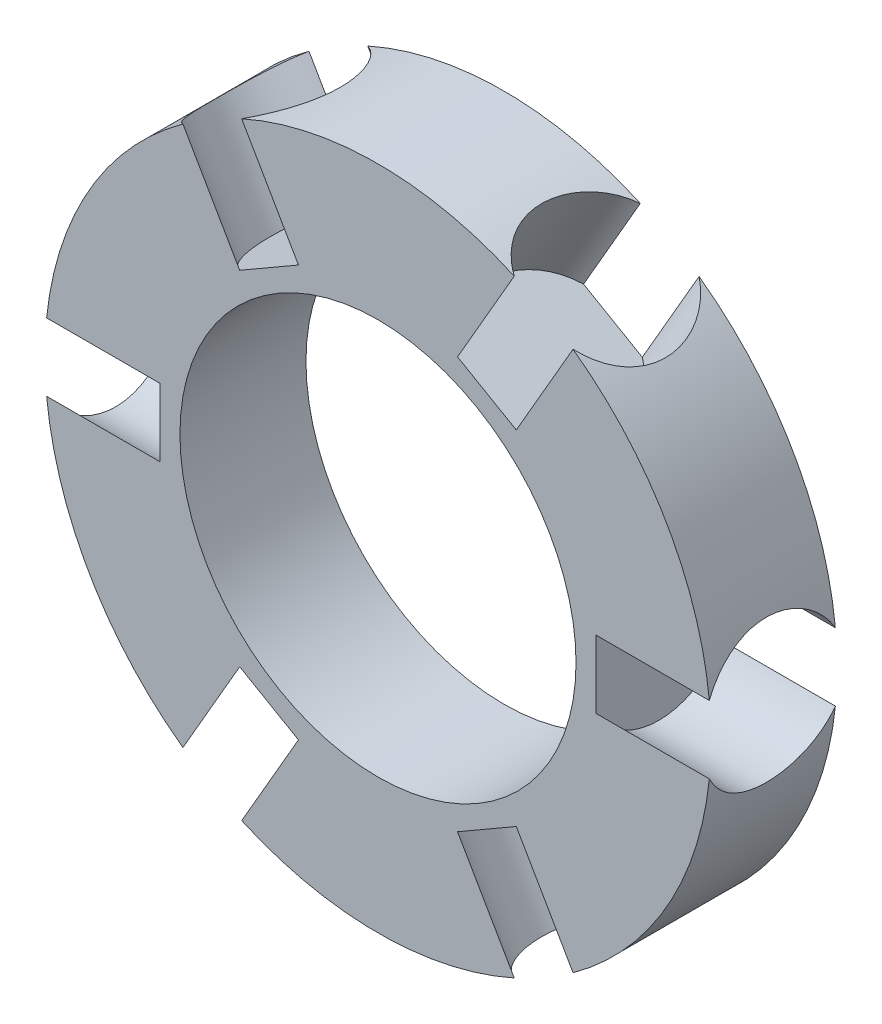
from build123d import *

# Parameters (mm, degrees)
SKETCH1_R           = 18.5
SKETCH1_R_2         = 11
BOSS_EXTRUDE1_DEPTH = 3.5
SKETCH2_R           = 3.975
CUT_EXTRUDE3_DEPTH  = 6.4
CIRPATTERN1_COUNT   = 6


with BuildPart() as part:
    # Sketch1 → Boss-Extrude1 (new, symmetric)
    with BuildSketch(Plane.XY):
        Circle(SKETCH1_R)
        Circle(SKETCH1_R_2, mode=Mode.SUBTRACT)
    extrude(amount=BOSS_EXTRUDE1_DEPTH, both=True)

    # Sketch2 → Cut-Extrude3 (cut)
    with BuildSketch(Plane(origin=(-18.5, -17.193061184, 0), x_dir=(0, -1, 0), z_dir=(1, 0, 0))):
        with Locations((-17.193061184, 0)):
            Circle(SKETCH2_R)
    cut_extrude3 = extrude(amount=CUT_EXTRUDE3_DEPTH, mode=Mode.SUBTRACT)

    # CirPattern1: Cut-Extrude3 ×6 about axis
    cirpattern1_axis = Axis((0, 0, 3.5), (0, 0, 1))
    for i in range(1, CIRPATTERN1_COUNT):
        add(cut_extrude3.rotate(cirpattern1_axis, i * 360 / CIRPATTERN1_COUNT), mode=Mode.SUBTRACT)


solid = part.part
